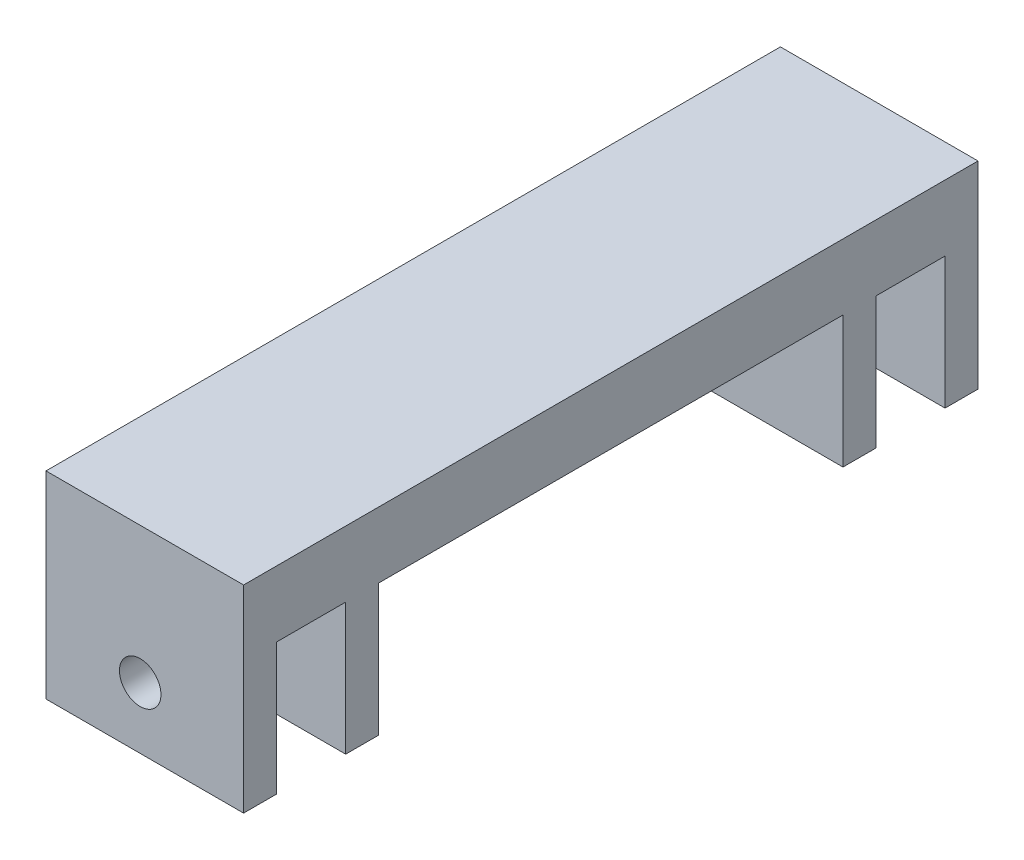
from build123d import *

# Parameters (mm, degrees)
ESQUISSE1_W             = 30
ESQUISSE1_H             = 10
BOSS_EXTRU_1_DEPTH      = 111.5
ESQUISSE2_W             = 30
ESQUISSE2_H             = 5
BOSS_EXTRU_2_DEPTH      = 20
ESQUISSE3_R             = 3.15
ENL_V_MAT_EXTRU_2_DEPTH = 118.184683299


with BuildPart() as part:
    # Esquisse1 → Boss.-Extru.1 (new body)
    with BuildSketch(Plane.XY):
        with Locations((15, 5)):
            Rectangle(ESQUISSE1_W, ESQUISSE1_H)
    extrude(amount=BOSS_EXTRU_1_DEPTH)

    # Esquisse2 → Boss.-Extru.2 (add)
    with BuildSketch(Plane.XZ):
        with Locations((15, 2.5)):
            Rectangle(ESQUISSE2_W, ESQUISSE2_H)
        with Locations((15, 18)):
            Rectangle(ESQUISSE2_W, ESQUISSE2_H)
        with Locations((15, 109)):
            Rectangle(ESQUISSE2_W, ESQUISSE2_H)
        with Locations((15, 93.5)):
            Rectangle(ESQUISSE2_W, ESQUISSE2_H)
    extrude(amount=BOSS_EXTRU_2_DEPTH)

    # Esquisse3 → Enlèv. mat.-Extru.2 (cut, through all)
    with BuildSketch(Plane.XY.offset(111.5)):
        with Locations((14.302143115, -10.686909811)):
            Circle(ESQUISSE3_R)
    extrude(amount=-ENL_V_MAT_EXTRU_2_DEPTH, mode=Mode.SUBTRACT)


solid = part.part
